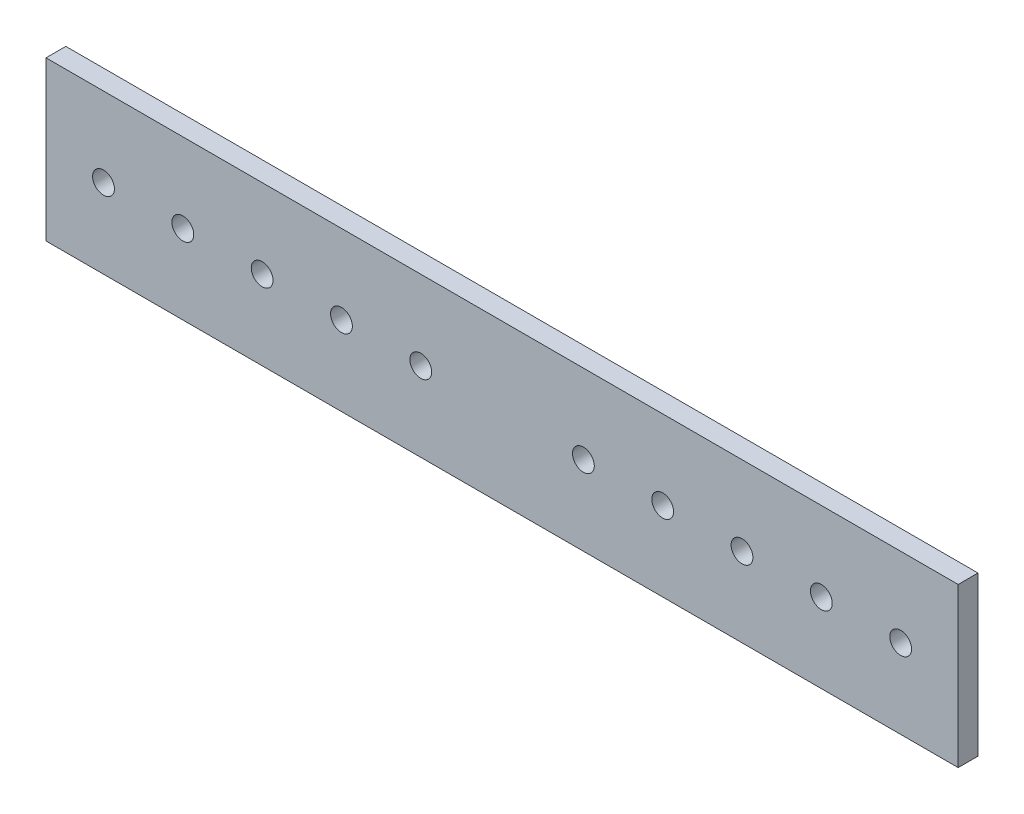
from build123d import *

# Parameters (mm, degrees)
ESQUISSE1_W                = 230
ESQUISSE1_H                = 40
BOSS_EXTRU_1_DEPTH         = 5
ESQUISSE2_R                = 2.75
ENL_V_MAT_EXTRU_1_DEPTH    = 117.833214455
ESQUISSE8_R                = 2.75
ENL_V_MAT_EXTRU_2_DEPTH    = 5
R_P_TITION_LIN_AIRE2_COUNT = 5
R_P_TITION_LIN_AIRE2_PITCH = 20
R_P_TITION_LIN_AIRE3_COUNT = 5
R_P_TITION_LIN_AIRE3_PITCH = 20


with BuildPart() as part:
    # Esquisse1 → Boss.-Extru.1 (new body)
    with BuildSketch(Plane.XY):
        Rectangle(ESQUISSE1_W, ESQUISSE1_H)
    extrude(amount=BOSS_EXTRU_1_DEPTH)

    # Esquisse2 → Enlèv. mat.-Extru.1 (cut, through all)
    with BuildSketch(Plane.XY.offset(5)):
        with Locations((20.5, 0)):
            Circle(ESQUISSE2_R)
    enl_v_mat_extru_1 = extrude(amount=-ENL_V_MAT_EXTRU_1_DEPTH, mode=Mode.SUBTRACT)

    # Esquisse8 → Enlèv. mat.-Extru.2 (cut)
    with BuildSketch(Plane(origin=(0, 0, 0), x_dir=(-1, 0, 0), z_dir=(0, 0, -1))):
        with Locations((20.5, 0)):
            Circle(ESQUISSE8_R)
    enl_v_mat_extru_2 = extrude(amount=-ENL_V_MAT_EXTRU_2_DEPTH, mode=Mode.SUBTRACT)

    # Répétition linéaire2: Enlèv. mat.-Extru.1 ×5
    with Locations(*[(i * R_P_TITION_LIN_AIRE2_PITCH, 0, 0) for i in range(1, R_P_TITION_LIN_AIRE2_COUNT)]):
        add(enl_v_mat_extru_1, mode=Mode.SUBTRACT)

    # Répétition linéaire3: Enlèv. mat.-Extru.2 ×5
    with Locations(*[(-i * R_P_TITION_LIN_AIRE3_PITCH, 0, 0) for i in range(1, R_P_TITION_LIN_AIRE3_COUNT)]):
        add(enl_v_mat_extru_2, mode=Mode.SUBTRACT)


solid = part.part
